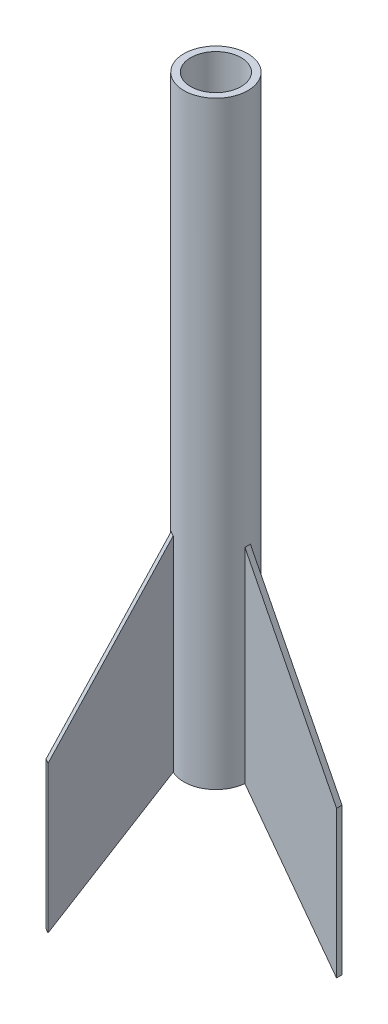
from build123d import *

# Parameters (mm, degrees)
SKETCH2_R           = 11.75
SKETCH2_R_2         = 9.25
BOSS_EXTRUDE1_DEPTH = 220
SKETCH5_R           = 9.5
SKETCH5_R_2         = 4.625
BOSS_EXTRUDE2_DEPTH = 12
BOSS_EXTRUDE3_DEPTH = 1
CIRPATTERN1_COUNT   = 3


with BuildPart() as part:
    # Sketch2 → Boss-Extrude1 (new body)
    with BuildSketch(Plane(origin=(-2.465768249, 0, -0.081027564), x_dir=(1, 0, 0), z_dir=(0, 1, 0))):
        with Locations((2.411661176, 0)):
            Circle(SKETCH2_R)
        with Locations((2.411661176, 0)):
            Circle(SKETCH2_R_2, mode=Mode.SUBTRACT)
    extrude(amount=BOSS_EXTRUDE1_DEPTH)

    # Sketch5 → Boss-Extrude2 (add)
    with BuildSketch(Plane(origin=(0, 60, 0), x_dir=(1, 0, 0), z_dir=(0, 1, 0))):
        with Locations((-0.054107074, 0.081027564)):
            Circle(SKETCH5_R)
        with Locations((-0.054107074, 0.081027564)):
            Circle(SKETCH5_R_2, mode=Mode.SUBTRACT)
    extrude(amount=BOSS_EXTRUDE2_DEPTH)

    # Sketch7 → Boss-Extrude3 (add, symmetric)
    with BuildSketch(Plane.XY):
        Polygon((11.695892926, 75.2), (9.828211369, 75.2), (10.695892926, 0), (11.695892926, 0), (45.34731611, -45), (45.34731611, 9), align=None)
    boss_extrude3 = extrude(amount=BOSS_EXTRUDE3_DEPTH, both=True)

    # CirPattern1: Boss-Extrude3 ×3 about axis
    cirpattern1_axis = Axis((-0.054107074, 220, -0.081027564), (0, -1, 0))
    for i in range(1, CIRPATTERN1_COUNT):
        add(boss_extrude3.rotate(cirpattern1_axis, i * 360 / CIRPATTERN1_COUNT))


solid = part.part
